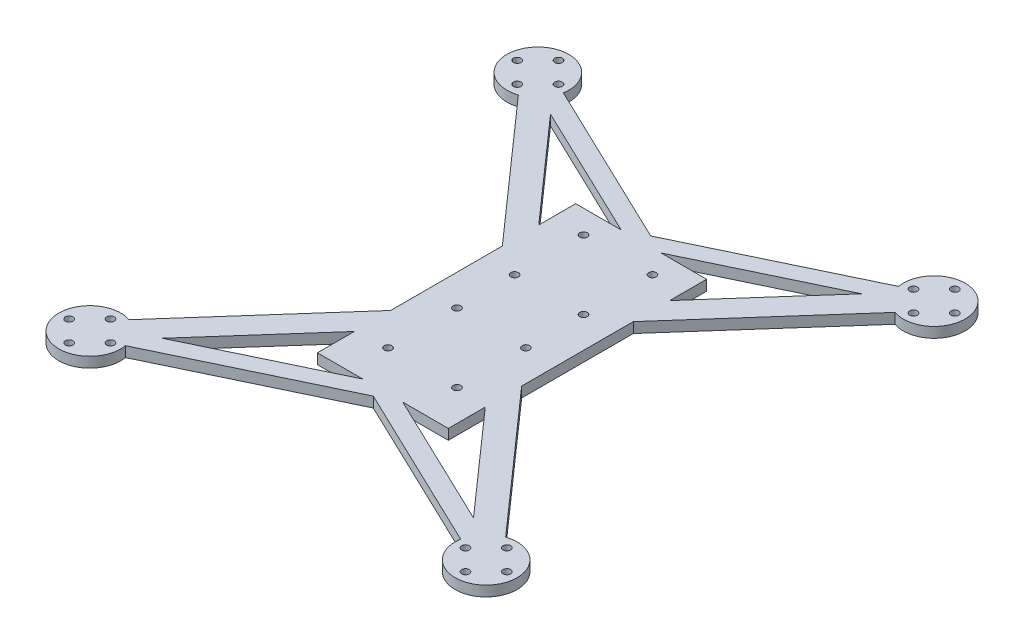
from build123d import *

# Parameters (mm, degrees)
SKETCH1_R           = 9
SKETCH1_R_2         = 1.1
SKETCH1_W           = 38
SKETCH1_H           = 74.95
BOSS_EXTRUDE1_DEPTH = 3


with BuildPart() as part:
    # Sketch1 → Boss-Extrude1 (new body)
    # profile 1 of 13: a face of its own
    with BuildSketch(Plane(origin=(0, 0, 0), x_dir=(1, 0, 0), z_dir=(0, 1, 0))):
        with Locations((-57.5, 65)):
            Circle(SKETCH1_R)
        with Locations((-57.5, 71)):
            Circle(SKETCH1_R_2, mode=Mode.SUBTRACT)
        with Locations((-63.5, 65)):
            Circle(SKETCH1_R_2, mode=Mode.SUBTRACT)
        with Locations((-57.5, 59)):
            Circle(SKETCH1_R_2, mode=Mode.SUBTRACT)
        with Locations((-51.5, 65)):
            Circle(SKETCH1_R_2, mode=Mode.SUBTRACT)
    # profile 2 of 13: a face of its own
    with BuildSketch(Plane(origin=(0, 0, 0), x_dir=(1, 0, 0), z_dir=(0, 1, 0))):
        with Locations((57.5, 65)):
            Circle(SKETCH1_R)
        with Locations((57.5, 59)):
            Circle(SKETCH1_R_2, mode=Mode.SUBTRACT)
        with Locations((51.5, 65)):
            Circle(SKETCH1_R_2, mode=Mode.SUBTRACT)
        with Locations((57.5, 71)):
            Circle(SKETCH1_R_2, mode=Mode.SUBTRACT)
        with Locations((63.5, 65)):
            Circle(SKETCH1_R_2, mode=Mode.SUBTRACT)
    # profile 3 of 13: a face of its own
    with BuildSketch(Plane(origin=(0, 0, 0), x_dir=(1, 0, 0), z_dir=(0, 1, 0))):
        with Locations((57.5, -65)):
            Circle(SKETCH1_R)
        with Locations((51.5, -65)):
            Circle(SKETCH1_R_2, mode=Mode.SUBTRACT)
        with Locations((57.5, -59)):
            Circle(SKETCH1_R_2, mode=Mode.SUBTRACT)
        with Locations((63.5, -65)):
            Circle(SKETCH1_R_2, mode=Mode.SUBTRACT)
        with Locations((57.5, -71)):
            Circle(SKETCH1_R_2, mode=Mode.SUBTRACT)
    # profile 4 of 13: a face of its own
    with BuildSketch(Plane(origin=(0, 0, 0), x_dir=(1, 0, 0), z_dir=(0, 1, 0))):
        with Locations((-57.5, -65)):
            Circle(SKETCH1_R)
        with Locations((-57.5, -59)):
            Circle(SKETCH1_R_2, mode=Mode.SUBTRACT)
        with Locations((-51.5, -65)):
            Circle(SKETCH1_R_2, mode=Mode.SUBTRACT)
        with Locations((-57.5, -71)):
            Circle(SKETCH1_R_2, mode=Mode.SUBTRACT)
        with Locations((-63.5, -65)):
            Circle(SKETCH1_R_2, mode=Mode.SUBTRACT)
    # profile 5 of 13: a face of its own
    with BuildSketch(Plane(origin=(0, 0, 0), x_dir=(1, 0, 0), z_dir=(0, 1, 0))):
        Rectangle(SKETCH1_W, SKETCH1_H)
        with Locations((-10, 30.75)):
            Circle(SKETCH1_R_2, mode=Mode.SUBTRACT)
        with Locations((10, 30.75)):
            Circle(SKETCH1_R_2, mode=Mode.SUBTRACT)
        with Locations((10, 10.75)):
            Circle(SKETCH1_R_2, mode=Mode.SUBTRACT)
        with Locations((-10, 10.75)):
            Circle(SKETCH1_R_2, mode=Mode.SUBTRACT)
        with Locations((-10, -5.975)):
            Circle(SKETCH1_R_2, mode=Mode.SUBTRACT)
        with Locations((10, -5.975)):
            Circle(SKETCH1_R_2, mode=Mode.SUBTRACT)
        with Locations((10, -25.975)):
            Circle(SKETCH1_R_2, mode=Mode.SUBTRACT)
        with Locations((-10, -25.975)):
            Circle(SKETCH1_R_2, mode=Mode.SUBTRACT)
    # profile 6 of 13: a face of its own
    with BuildSketch(Plane(origin=(0, 0, 0), x_dir=(1, 0, 0), z_dir=(0, 1, 0))):
        Polygon((-19, 16.1958311), (-54.627715561, 56.470639995), (-49.384739623, 61.10865717), (-13.757024063, 20.833848275), align=None)
    # profile 7 of 13: a face of its own
    with BuildSketch(Plane(origin=(0, 0, 0), x_dir=(1, 0, 0), z_dir=(0, 1, 0))):
        Polygon((-50.781077312, 59.012005518), (3.631184446, 32.965092389), (5.790057611, 37.475), (-48.622204147, 63.521913129), align=None)
    # profile 8 of 13: a face of its own
    with BuildSketch(Plane(origin=(0, 0, 0), x_dir=(1, 0, 0), z_dir=(0, 1, 0))):
        Polygon((50.781077312, 59.012005518), (48.622204147, 63.521913129), (-5.790057611, 37.475), (-3.631184446, 32.965092389), align=None)
    # profile 9 of 13: a face of its own
    with BuildSketch(Plane(origin=(0, 0, 0), x_dir=(1, 0, 0), z_dir=(0, 1, 0))):
        Polygon((19, 16.1958311), (13.757024063, 20.833848275), (49.384739623, 61.10865717), (54.627715561, 56.470639995), align=None)
    # profile 10 of 13: a face of its own
    with BuildSketch(Plane(origin=(0, 0, 0), x_dir=(1, 0, 0), z_dir=(0, 1, 0))):
        Polygon((19, -16.1958311), (13.757024063, -20.833848275), (49.384739623, -61.10865717), (54.627715561, -56.470639995), align=None)
    # profile 11 of 13: a face of its own
    with BuildSketch(Plane(origin=(0, 0, 0), x_dir=(1, 0, 0), z_dir=(0, 1, 0))):
        Polygon((50.781077312, -59.012005518), (48.622204147, -63.521913129), (-5.790057611, -37.475), (-3.631184446, -32.965092389), align=None)
    # profile 12 of 13: a face of its own
    with BuildSketch(Plane(origin=(0, 0, 0), x_dir=(1, 0, 0), z_dir=(0, 1, 0))):
        Polygon((-50.781077312, -59.012005518), (-48.622204147, -63.521913129), (5.790057611, -37.475), (3.631184446, -32.965092389), align=None)
    # profile 13 of 13: a face of its own
    with BuildSketch(Plane(origin=(0, 0, 0), x_dir=(1, 0, 0), z_dir=(0, 1, 0))):
        Polygon((-19, -16.1958311), (-13.757024063, -20.833848275), (-49.384739623, -61.10865717), (-54.627715561, -56.470639995), align=None)
    extrude(amount=BOSS_EXTRUDE1_DEPTH)


solid = part.part
